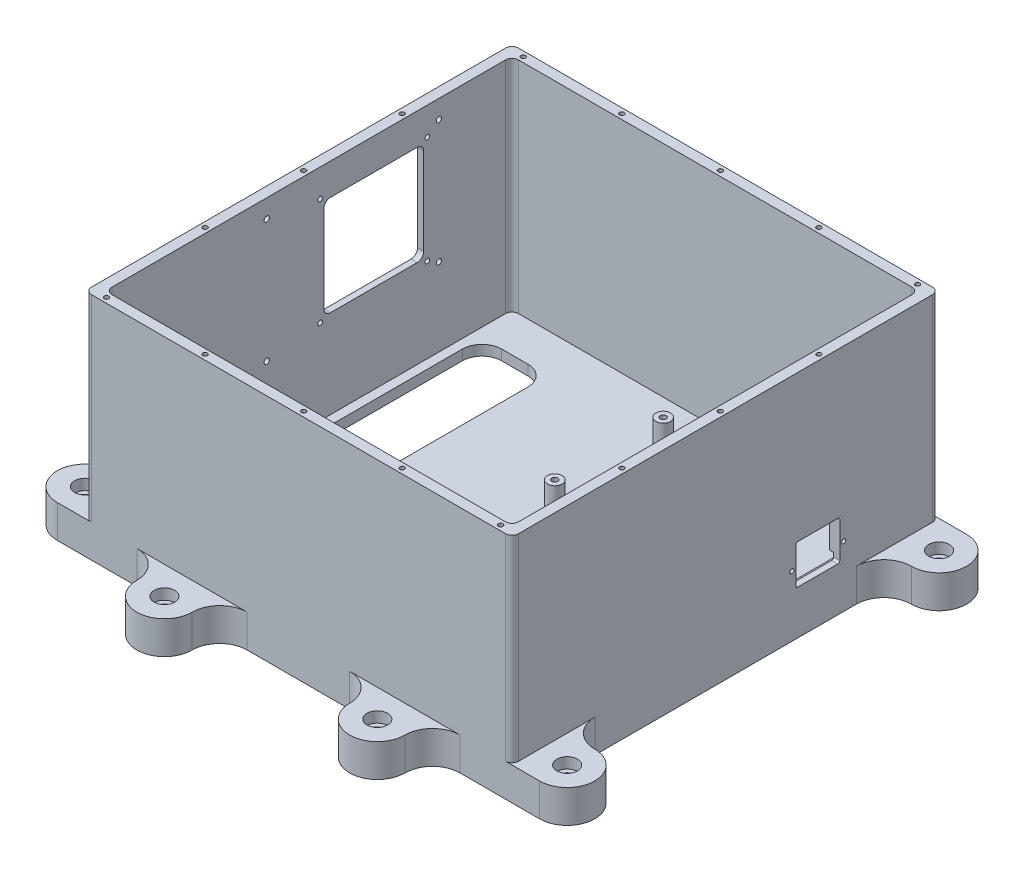
from build123d import *

# Parameters (mm, degrees)
SKETCH1_W                                      = 165.1
SKETCH1_H                                      = 165.1
BOSS_EXTRUDE1_DEPTH                            = 88.9
SHELL1_T                                       = -3.9624
FILLET1_R                                      = 2.54
SKETCH8_R                                      = 2.8448
BOSS_EXTRUDE5_DEPTH                            = 6.35
SKETCH17_R                                     = 2.8448
BOSS_EXTRUDE6_DEPTH                            = 12.7
CUT_EXTRUDE8_DEPTH                             = 249.456064313
CUT_EXTRUDE8_DEPTH_BACK                        = 249.456064313
BOSS_EXTRUDE7_DEPTH                            = 12.7
F_4_40_TAPPED_HOLE1_D                          = 2.2606
F_4_40_TAPPED_HOLE1_DEPTH                      = 8.89
F_4_40_TAPPED_HOLE1_TIP                        = 0.679152758
F_4_40_TAPPED_HOLE2_D                          = 2.2606
F_4_40_TAPPED_HOLE2_DEPTH                      = 6.35
F_4_40_TAPPED_HOLE2_TIP                        = 0.679152758
CUT_EXTRUDE9_REACH                             = 280.244
SKETCH34_W                                     = 17.018
SKETCH34_H                                     = 15.24
FILLET2_R                                      = 0.762
CBORE_FOR_8_SOCKET_HEAD_CAP_SCREW2_D           = 4.4958
CBORE_FOR_8_SOCKET_HEAD_CAP_SCREW2_CBORE_D     = 7.9375
CBORE_FOR_8_SOCKET_HEAD_CAP_SCREW2_CBORE_DEPTH = 4.1656
SKETCH38_W                                     = 38.608
SKETCH38_H                                     = 38.608
CUT_EXTRUDE11_DEPTH                            = 3.9624
SKETCH39_W                                     = 46.5328
SKETCH39_H                                     = 46.5328
CUT_EXTRUDE12_DEPTH                            = 1.5875
FILLET4_R                                      = 2.54
M2_5X0_45_TAPPED_HOLE1_D                       = 2.05
M2_5X0_45_TAPPED_HOLE1_DEPTH                   = 25.2984
F_2_56_TAPPED_HOLE1_D                          = 1.778
F_2_56_TAPPED_HOLE1_DEPTH                      = 2.3749
F_2_56_TAPPED_HOLE1_TIP                        = 0.53416509
FILLET5_R                                      = 2.54
F_2_56_TAPPED_HOLE2_D                          = 1.778
F_2_56_TAPPED_HOLE2_DEPTH                      = 6.604
F_2_56_TAPPED_HOLE2_TIP                        = 0.53416509
M2X0_4_TAPPED_HOLE1_D                          = 1.6
M2X0_4_TAPPED_HOLE1_DEPTH                      = 3.9624
M2X0_4_TAPPED_HOLE1_TIP                        = 0.480688495
SKETCH49_W                                     = 55.88
SKETCH49_H                                     = 3.302
CUT_EXTRUDE13_DEPTH                            = 1.5875


# Read off the part's stored shape, not the designer's step: AlignGroup7
with BuildPart() as part:
    # Sketch1 → Boss-Extrude1 (new body)
    with BuildSketch(Plane(origin=(0, 0, 0), x_dir=(1, 0, 0), z_dir=(0, 1, 0))):
        with Locations((82.55, 82.55)):
            Rectangle(SKETCH1_W, SKETCH1_H)
    extrude(amount=BOSS_EXTRUDE1_DEPTH)

    # Shell1
    shell1_openings = [part.faces().sort_by_distance(p)[0] for p in [
        (82.55, 88.9, -82.55),
    ]]
    offset(amount=SHELL1_T, openings=shell1_openings, kind=Kind.INTERSECTION)

    # Fillet1
    fillet1_edges = [part.edges().sort_by_distance(p)[0] for p in [
        (3.9624, 46.4312, -161.1376),
        (3.9624, 46.4312, -3.9624),
        (161.1376, 46.4312, -3.9624),
        (161.1376, 46.4312, -161.1376),
    ]]
    fillet(fillet1_edges, radius=FILLET1_R)

    # Sketch8 → Boss-Extrude5 (add)
    with BuildSketch(Plane(origin=(0, 3.9624, 0), x_dir=(1, 0, 0), z_dir=(0, 1, 0))):
        with Locations(Location((116.6876, 29.3624, 0), (0, 0, 90))):
            Circle(SKETCH8_R)
        with Locations(Location((116.6876, 76.3524, 0), (0, 0, 90))):
            Circle(SKETCH8_R)
        with Locations(Location((82.6516, 76.3524, 0), (0, 0, 90))):
            Circle(SKETCH8_R)
        with Locations(Location((82.6516, 29.3624, 0), (0, 0, 90))):
            Circle(SKETCH8_R)
        with Locations(Location((48.6156, 29.3624, 0), (0, 0, 90))):
            Circle(SKETCH8_R)
        with Locations(Location((48.6156, 76.3524, 0), (0, 0, 90))):
            Circle(SKETCH8_R)
    extrude(amount=BOSS_EXTRUDE5_DEPTH)

    # Sketch17 → Boss-Extrude6 (add)
    with BuildSketch(Plane(origin=(0, 3.9624, 0), x_dir=(1, 0, 0), z_dir=(0, 1, 0))):
        with Locations(Location((81.8388, 99.8093, 0), (0, 0, 90))):
            Circle(SKETCH17_R)
        with Locations(Location((81.8388, 141.7193, 0), (0, 0, 90))):
            Circle(SKETCH17_R)
        with Locations(Location((147.8788, 144.8943, 0), (0, 0, 90))):
            Circle(SKETCH17_R)
        with Locations(Location((147.8788, 96.6343, 0), (0, 0, 90))):
            Circle(SKETCH17_R)
    extrude(amount=BOSS_EXTRUDE6_DEPTH)

    # Sketch20 → Cut-Extrude8 (cut, two sides: drawn at the far end of the back side and taken through both)
    with BuildSketch(Plane(origin=(0, 3.9624, 0), x_dir=(1, 0, 0), z_dir=(0, 1, 0)).offset(-CUT_EXTRUDE8_DEPTH_BACK)):
        with BuildLine():
            Line((15.100647408, 146.0246), (25.260647408, 146.0246))
            ThreePointArc((25.260647408, 146.0246), (30.648801081, 143.792753673), (32.880647408, 138.4046))
            Line((32.880647408, 138.4046), (32.880647408, 26.6446))
            ThreePointArc((32.880647408, 26.6446), (30.648801081, 21.256446327), (25.260647408, 19.0246))
            Line((25.260647408, 19.0246), (15.100647408, 19.0246))
            ThreePointArc((15.100647408, 19.0246), (9.712493735, 21.256446327), (7.480647408, 26.6446))
            Line((7.480647408, 26.6446), (7.480647408, 138.4046))
            ThreePointArc((7.480647408, 138.4046), (9.712493735, 143.792753673), (15.100647408, 146.0246))
        make_face()
    extrude(amount=CUT_EXTRUDE8_DEPTH + CUT_EXTRUDE8_DEPTH_BACK, mode=Mode.SUBTRACT)

    # Sketch21 → Boss-Extrude7 (add)
    with BuildSketch(Plane(origin=(0, 0, 0), x_dir=(-1, 0, 0), z_dir=(0, -1, 0))):
        with BuildLine():
            Line((0, 32.004), (0, 0))
            Line((0, 0), (10.668, 0))
            ThreePointArc((10.668, 0), (21.336, 10.668), (10.668, 21.336))
            ThreePointArc((10.668, 21.336), (3.124584858, 24.460584858), (0, 32.004))
        make_face()
        with BuildLine():
            Line((-175.768, 0), (-165.1, 0))
            Line((-165.1, 0), (-165.1, 32.004))
            ThreePointArc((-165.1, 32.004), (-168.224584858, 24.460584858), (-175.768, 21.336))
            ThreePointArc((-175.768, 21.336), (-186.436, 10.668), (-175.768, 0))
        make_face()
        with BuildLine():
            Line((-165.1, 133.096), (-165.1, 165.1))
            Line((-165.1, 165.1), (-175.768, 165.1))
            ThreePointArc((-175.768, 165.1), (-186.436, 154.432), (-175.768, 143.764))
            ThreePointArc((-175.768, 143.764), (-168.224584858, 140.639415142), (-165.1, 133.096))
        make_face()
        with BuildLine():
            Line((10.668, 165.1), (0, 165.1))
            Line((0, 165.1), (0, 133.096))
            ThreePointArc((0, 133.096), (3.124584858, 140.639415142), (10.668, 143.764))
            ThreePointArc((10.668, 143.764), (21.336, 154.432), (10.668, 165.1))
        make_face()
        with BuildLine():
            ThreePointArc((-134.366, 175.768), (-137.490584858, 168.224584858), (-145.034, 165.1))
            Line((-145.034, 165.1), (-102.362, 165.1))
            ThreePointArc((-102.362, 165.1), (-109.905415142, 168.224584858), (-113.03, 175.768))
            ThreePointArc((-113.03, 175.768), (-123.698, 186.436), (-134.366, 175.768))
        make_face()
        with BuildLine():
            ThreePointArc((-52.07, 175.768), (-55.194584858, 168.224584858), (-62.738, 165.1))
            Line((-62.738, 165.1), (-20.066, 165.1))
            ThreePointArc((-20.066, 165.1), (-27.609415142, 168.224584858), (-30.734, 175.768))
            ThreePointArc((-30.734, 175.768), (-41.402, 186.436), (-52.07, 175.768))
        make_face()
        with BuildLine():
            Line((-20.066, 0), (-62.738, 0))
            ThreePointArc((-62.738, 0), (-55.194584858, -3.124584858), (-52.07, -10.668))
            ThreePointArc((-52.07, -10.668), (-41.402, -21.336), (-30.734, -10.668))
            ThreePointArc((-30.734, -10.668), (-27.609415142, -3.124584858), (-20.066, 0))
        make_face()
        with BuildLine():
            Line((-102.362, 0), (-145.034, 0))
            ThreePointArc((-145.034, 0), (-137.490584858, -3.124584858), (-134.366, -10.668))
            ThreePointArc((-134.366, -10.668), (-123.698, -21.336), (-113.03, -10.668))
            ThreePointArc((-113.03, -10.668), (-109.905415142, -3.124584858), (-102.362, 0))
        make_face()
    extrude(amount=-BOSS_EXTRUDE7_DEPTH)

    # #4-40 Tapped Hole1
    with Locations(Plane(origin=(0, 16.6624, 0), x_dir=(1, 0, 0), z_dir=(0, 1, 0))):
        with Locations((81.8388, 141.7193), (147.8788, 144.8943), (81.8388, 99.8093), (147.8788, 96.6343)):
            Hole(F_4_40_TAPPED_HOLE1_D / 2, depth=F_4_40_TAPPED_HOLE1_DEPTH)
            with Locations((0, 0, -(F_4_40_TAPPED_HOLE1_DEPTH + F_4_40_TAPPED_HOLE1_TIP / 2))):  # 118° drill point
                Cone(0, F_4_40_TAPPED_HOLE1_D / 2, F_4_40_TAPPED_HOLE1_TIP, mode=Mode.SUBTRACT)

    # #4-40 Tapped Hole2
    with Locations(Plane(origin=(0, 10.3124, 0), x_dir=(1, 0, 0), z_dir=(0, 1, 0))):
        with Locations((48.6156, 76.3524), (82.6516, 76.3524), (116.6876, 76.3524), (48.6156, 29.3624), (82.6516, 29.3624), (116.6876, 29.3624)):
            Hole(F_4_40_TAPPED_HOLE2_D / 2, depth=F_4_40_TAPPED_HOLE2_DEPTH)
            with Locations((0, 0, -(F_4_40_TAPPED_HOLE2_DEPTH + F_4_40_TAPPED_HOLE2_TIP / 2))):  # 118° drill point
                Cone(0, F_4_40_TAPPED_HOLE2_D / 2, F_4_40_TAPPED_HOLE2_TIP, mode=Mode.SUBTRACT)

    # Sketch34 → Cut-Extrude9 (cut, up to next)
    with BuildSketch(Plane(origin=(165.1, 0, 0), x_dir=(0, 0, -1), z_dir=(1, 0, 0)), mode=Mode.PRIVATE) as cut_extrude9_sk1:
        with Locations((118.237, 24.6634)):
            Rectangle(SKETCH34_W, SKETCH34_H)
    cut_extrude9_tool1 = extrude(cut_extrude9_sk1.sketch, amount=-CUT_EXTRUDE9_REACH, mode=Mode.PRIVATE) & part.part
    add(cut_extrude9_tool1.solids().sort_by_distance((165.1, 24.6634, -118.237))[0], mode=Mode.SUBTRACT)

    # Fillet2
    fillet2_edges = [part.edges().sort_by_distance(p)[0] for p in [
        (163.1188, 17.0434, -126.746),
        (163.1188, 32.2834, -126.746),
        (163.1188, 32.2834, -109.728),
        (163.1188, 17.0434, -109.728),
    ]]
    fillet(fillet2_edges, radius=FILLET2_R)

    # CBORE for #8 Socket Head Cap Screw2 (through all)
    with Locations(Plane(origin=(0, 12.7, 0), x_dir=(1, 0, 0), z_dir=(0, 1, 0))):
        with Locations((-10.668, 154.432), (-10.668, 10.668), (175.768, 154.432), (175.768, 10.668), (41.402, -10.668), (123.698, -10.668), (123.698, 175.768), (41.402, 175.768)):
            CounterBoreHole(CBORE_FOR_8_SOCKET_HEAD_CAP_SCREW2_D / 2, CBORE_FOR_8_SOCKET_HEAD_CAP_SCREW2_CBORE_D / 2, CBORE_FOR_8_SOCKET_HEAD_CAP_SCREW2_CBORE_DEPTH)

    # Sketch38 → Cut-Extrude11 (cut)
    with BuildSketch(Plane.ZY):
        with Locations((-107.696, 57.404)):
            Rectangle(SKETCH38_W, SKETCH38_H)
    extrude(amount=-CUT_EXTRUDE11_DEPTH, mode=Mode.SUBTRACT)

    # Sketch39 → Cut-Extrude12 (cut)
    with BuildSketch(Plane.ZY):
        with Locations((-107.696, 57.404)):
            Rectangle(SKETCH39_W, SKETCH39_H)
    extrude(amount=-CUT_EXTRUDE12_DEPTH, mode=Mode.SUBTRACT)

    # Fillet4
    fillet4_edges = [part.edges().sort_by_distance(p)[0] for p in [
        (2.77495, 38.1, -88.392),
        (2.77495, 76.708, -88.392),
        (2.77495, 76.708, -127),
        (2.77495, 38.1, -127),
        (0.79375, 34.1376, -130.9624),
        (0.79375, 80.6704, -130.9624),
        (0.79375, 80.6704, -84.4296),
        (0.79375, 34.1376, -84.4296),
    ]]
    fillet(fillet4_edges, radius=FILLET4_R)

    # M2.5x0.45 Tapped Hole1
    with Locations(Plane(origin=(3.9624, 0, 0), x_dir=(0, 0, -1), z_dir=(1, 0, 0))):
        with Locations((66.31686, 81.788), (132.87756, 81.788), (132.87756, 34.163), (66.31686, 34.163)):
            Hole(M2_5X0_45_TAPPED_HOLE1_D / 2, depth=M2_5X0_45_TAPPED_HOLE1_DEPTH)

    # #2-56 Tapped Hole1
    with Locations(Plane.ZY.offset(-1.5875)):
        with Locations((-128.4224, 78.1304), (-86.9696, 78.1304), (-86.9696, 36.6776), (-128.4224, 36.6776)):
            Hole(F_2_56_TAPPED_HOLE1_D / 2, depth=F_2_56_TAPPED_HOLE1_DEPTH)
            with Locations((0, 0, -(F_2_56_TAPPED_HOLE1_DEPTH + F_2_56_TAPPED_HOLE1_TIP / 2))):  # 118° drill point
                Cone(0, F_2_56_TAPPED_HOLE1_D / 2, F_2_56_TAPPED_HOLE1_TIP, mode=Mode.SUBTRACT)

    # Fillet5
    fillet5_edges = [part.edges().sort_by_distance(p)[0] for p in [
        (0, 50.8, -165.1),
        (165.1, 50.8, -165.1),
        (165.1, 50.8, 0),
        (0, 50.8, 0),
    ]]
    fillet(fillet5_edges, radius=FILLET5_R)

    # #2-56 Tapped Hole2
    with Locations(Plane(origin=(0, 88.9, 0), x_dir=(1, 0, 0), z_dir=(0, 1, 0))):
        with Locations((158.75, 163.1188), (120.65, 163.1188), (82.55, 163.1188), (44.45, 163.1188), (6.35, 163.1188), (163.1188, 120.65), (163.1188, 82.55), (163.1188, 44.45), (158.75, 1.9812), (120.65, 1.9812), (82.55, 1.9812), (44.45, 1.9812), (6.35, 1.9812), (1.9812, 120.65), (1.9812, 82.55), (1.9812, 44.45)):
            Hole(F_2_56_TAPPED_HOLE2_D / 2, depth=F_2_56_TAPPED_HOLE2_DEPTH)
            with Locations((0, 0, -(F_2_56_TAPPED_HOLE2_DEPTH + F_2_56_TAPPED_HOLE2_TIP / 2))):  # 118° drill point
                Cone(0, F_2_56_TAPPED_HOLE2_D / 2, F_2_56_TAPPED_HOLE2_TIP, mode=Mode.SUBTRACT)

    # M2x0.4 Tapped Hole1
    with Locations(Plane(origin=(165.1, 0, 0), x_dir=(0, 0, -1), z_dir=(1, 0, 0))):
        with Locations((108.23702, 23.495), (128.23698, 23.495)):
            Hole(M2X0_4_TAPPED_HOLE1_D / 2, depth=M2X0_4_TAPPED_HOLE1_DEPTH)
            with Locations((0, 0, -(M2X0_4_TAPPED_HOLE1_DEPTH + M2X0_4_TAPPED_HOLE1_TIP / 2))):  # 118° drill point
                Cone(0, M2X0_4_TAPPED_HOLE1_D / 2, M2X0_4_TAPPED_HOLE1_TIP, mode=Mode.SUBTRACT)

    # Sketch49 → Cut-Extrude13 (cut)
    with BuildSketch(Plane.ZY.offset(-161.1376)):
        with Locations((-120.1547, 17.653)):
            Rectangle(SKETCH49_W, SKETCH49_H)
    extrude(amount=-CUT_EXTRUDE13_DEPTH, mode=Mode.SUBTRACT)


solid = part.part
